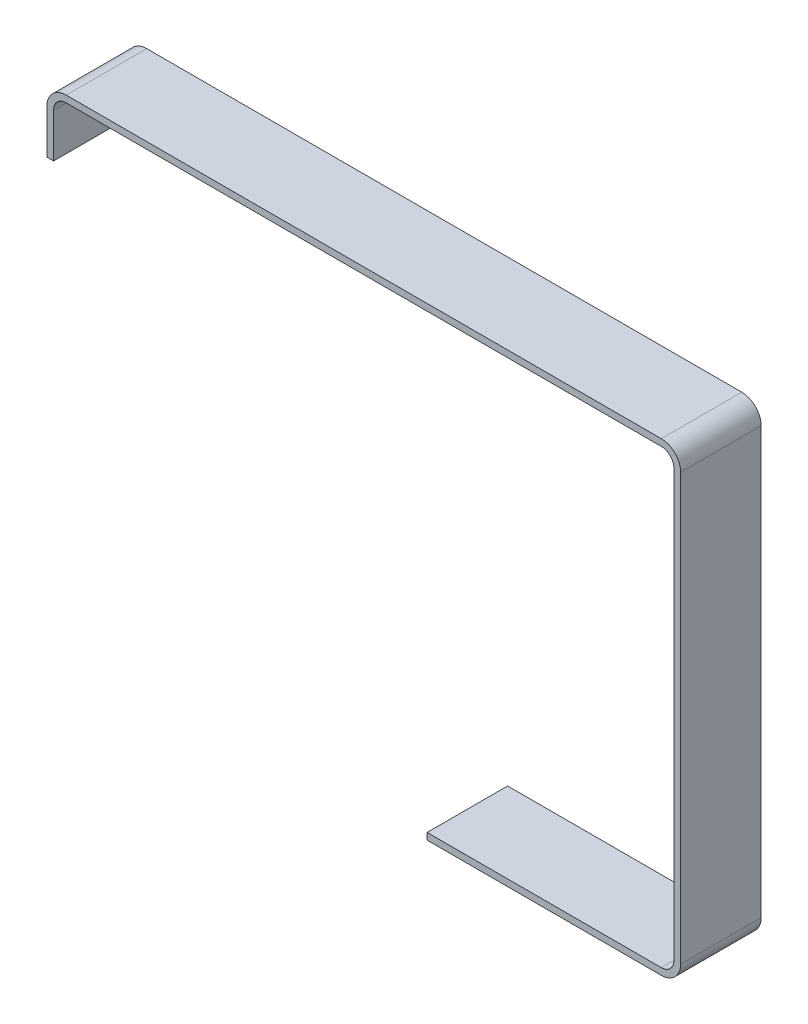
from build123d import *

# Parameters (mm, degrees)
BOSS_EXTRUDE1_DEPTH = 19.05
FILLET1_R           = 3
FILLET2_R           = 4.5875


with BuildPart() as part:
    # Sketch1 → Boss-Extrude1 (new body)
    with BuildSketch(Plane.XY):
        Polygon((-60, 0), (0, 0), (0, 110), (-150, 110), (-150, 95), (-148.4125, 95), (-148.4125, 108.4125), (-1.5875, 108.4125), (-1.5875, 1.5875), (-60, 1.5875), align=None)
    extrude(amount=BOSS_EXTRUDE1_DEPTH)

    # Fillet1
    fillet1_edges = [part.edges().sort_by_distance(p)[0] for p in [
        (-1.5875, 1.5875, 9.525),
        (-1.5875, 108.4125, 9.525),
        (-148.4125, 108.4125, 9.525),
    ]]
    fillet(fillet1_edges, radius=FILLET1_R)

    # Fillet2
    fillet2_edges = [part.edges().sort_by_distance(p)[0] for p in [
        (0, 0, 9.525),
        (0, 110, 9.525),
        (-150, 110, 9.525),
    ]]
    fillet(fillet2_edges, radius=FILLET2_R)


solid = part.part
